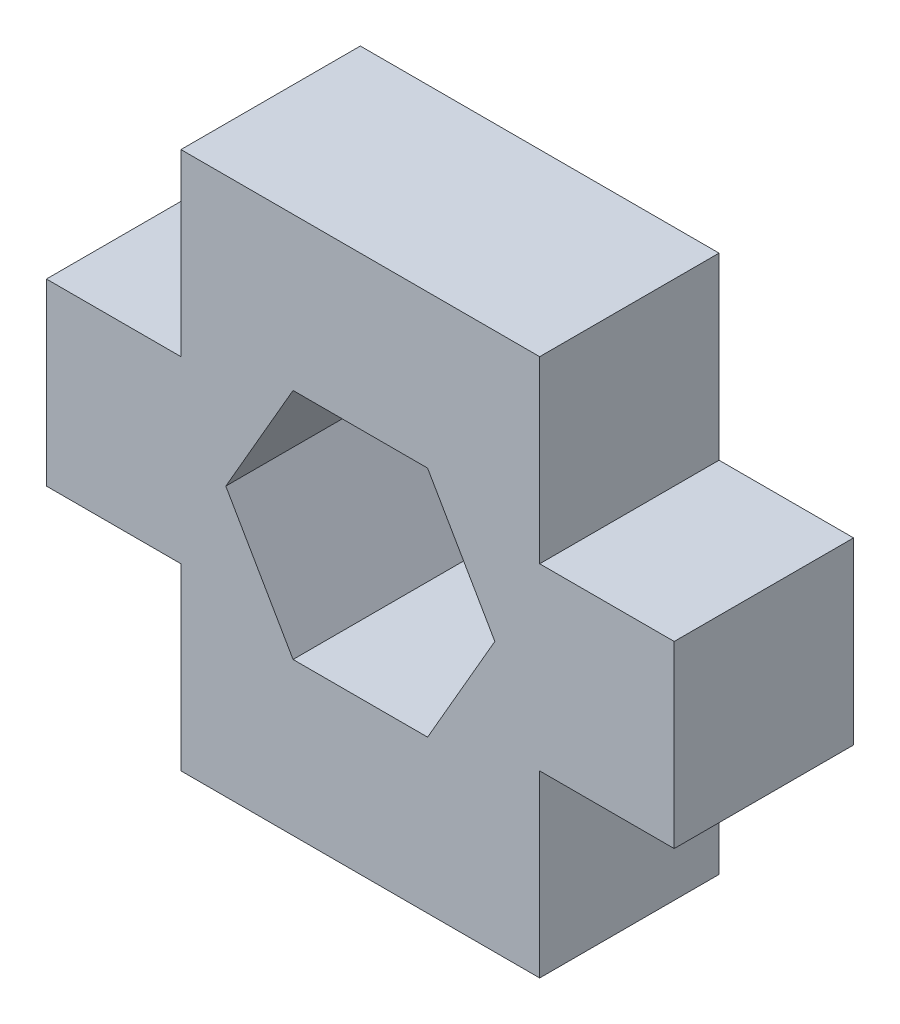
from build123d import *

# Parameters (mm, degrees)
BOSS_EXTRUDE1_DEPTH = 4


with BuildPart() as part:
    # Sketch1 → Boss-Extrude1 (new body)
    with BuildSketch(Plane.XY):
        Polygon((0, 0), (8, 0), (8, 4), (11, 4), (11, 8), (8, 8), (8, 12), (0, 12), (0, 8), (-3, 8), (-3, 4), (0, 4), align=None)
        Polygon((7, 6), (5.5, 8.598076211), (2.5, 8.598076211), (1, 6), (2.5, 3.401923789), (5.5, 3.401923789), align=None, mode=Mode.SUBTRACT)
    extrude(amount=BOSS_EXTRUDE1_DEPTH)


solid = part.part
